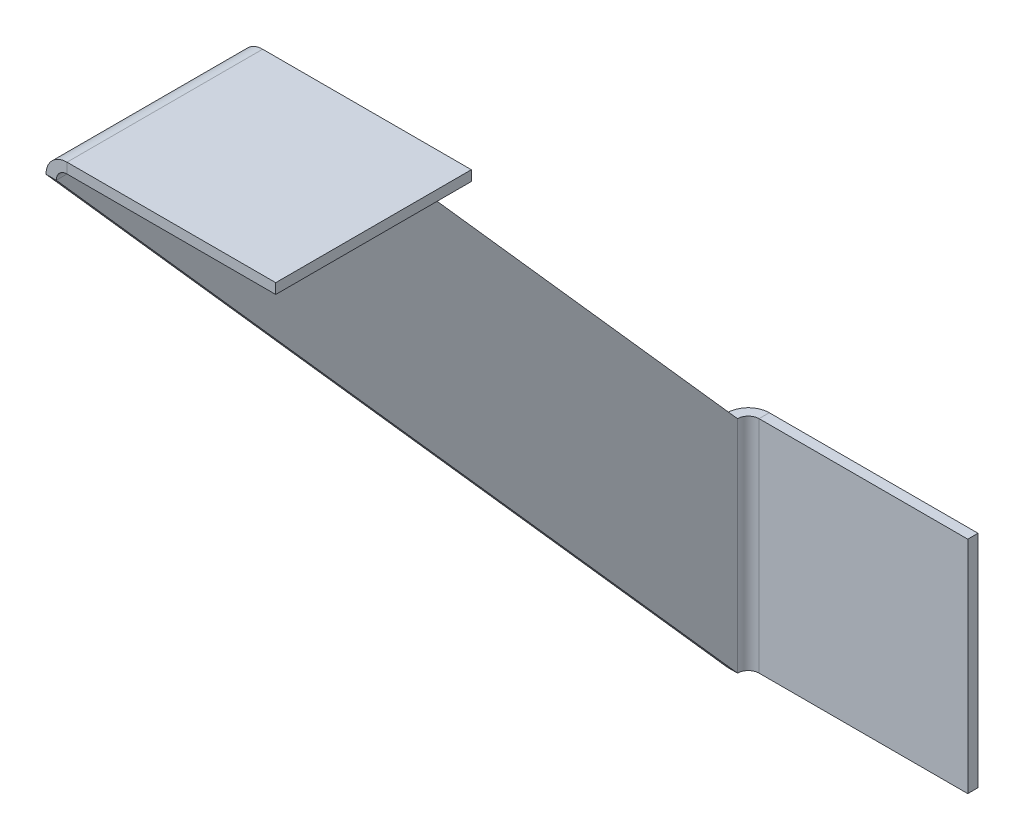
from build123d import *

# Parameters (mm, degrees)
BASE_FLANGE1_DEPTH      = 0.7
EDGE_FLANGE1_DEPTH      = 13.370958639
EDGE_FLANGE1_BEND_DEPTH = 15.064251929


# Sheet-metal steps are written as plain solids
with BuildPart() as part:
    # Sketch1 → Base-Flange1 (new body)
    with BuildSketch(Plane(origin=(0, 0, 0), x_dir=(0, 0, -1), z_dir=(1, 0, 0))):
        Polygon((0, 0), (-13.370958639, 0), (33.191160263, -52.458728532), (33.191160263, -37.394476603), align=None)
    extrude(amount=-BASE_FLANGE1_DEPTH)

    # Edge-Flange1 section (across the edge) → Edge-Flange1 (add)
    with BuildSketch(Plane(origin=(0, 0.7366, 0), x_dir=(0, -1, 0), z_dir=(0, 0, 1))):
        with BuildLine():
            Line((-0.7, 0.7366), (-0.7, 15))
            Line((-0.7, 15), (0, 15))
            Line((0, 15), (0, 0.7366))
            ThreePointArc((0, 0.7366), (0.215745145, 0.215745145), (0.7366, 0))
            Line((0.7366, 0), (0.7366, -0.7))
            ThreePointArc((0.7366, -0.7), (-0.279229602, -0.279229602), (-0.7, 0.7366))
        make_face()
    extrude(amount=EDGE_FLANGE1_DEPTH)

    # Edge-Flange1 section 2 (across the edge) → Edge-Flange1 bend (add)
    with BuildSketch(Plane(origin=(0, -52.458728532, -33.927760263), x_dir=(0, 0, 1), z_dir=(0, 1, 0))):
        with BuildLine():
            Line((-0.7, 0.7366), (-0.7, 15))
            Line((-0.7, 15), (0, 15))
            Line((0, 15), (0, 0.7366))
            ThreePointArc((0, 0.7366), (0.215745145, 0.215745145), (0.7366, 0))
            Line((0.7366, 0), (0.7366, -0.7))
            ThreePointArc((0.7366, -0.7), (-0.279229602, -0.279229602), (-0.7, 0.7366))
        make_face()
    extrude(amount=EDGE_FLANGE1_BEND_DEPTH)


solid = part.part
